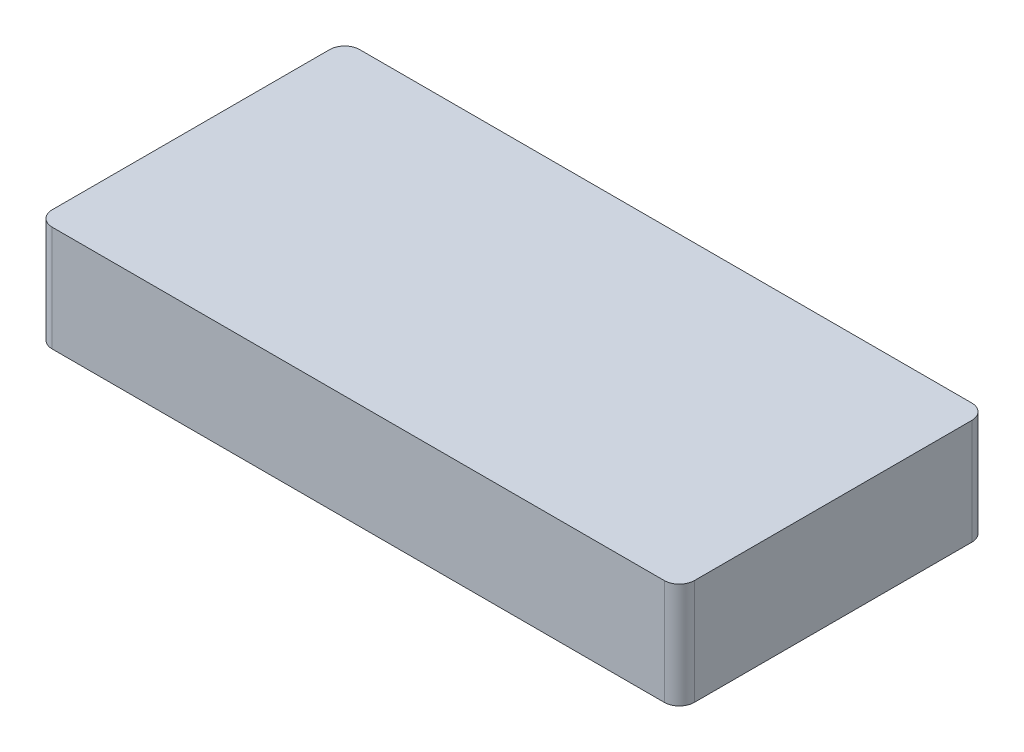
from build123d import *

# Parameters (mm, degrees)
SKETCH1_W           = 54.102
SKETCH1_H           = 25.908
BOSS_EXTRUDE1_DEPTH = 8.89
FILLET1_R           = 1.27


with BuildPart() as part:
    # Sketch1 → Boss-Extrude1 (new body)
    with BuildSketch(Plane(origin=(0, 0, 0), x_dir=(1, 0, 0), z_dir=(0, 1, 0))):
        Rectangle(SKETCH1_W, SKETCH1_H)
    extrude(amount=BOSS_EXTRUDE1_DEPTH)

    # Fillet1
    fillet1_edges = [part.edges().sort_by_distance(p)[0] for p in [
        (-27.051, 4.445, -12.954),
        (-27.051, 4.445, 12.954),
        (27.051, 4.445, -12.954),
        (27.051, 4.445, 12.954),
    ]]
    fillet(fillet1_edges, radius=FILLET1_R)


solid = part.part
